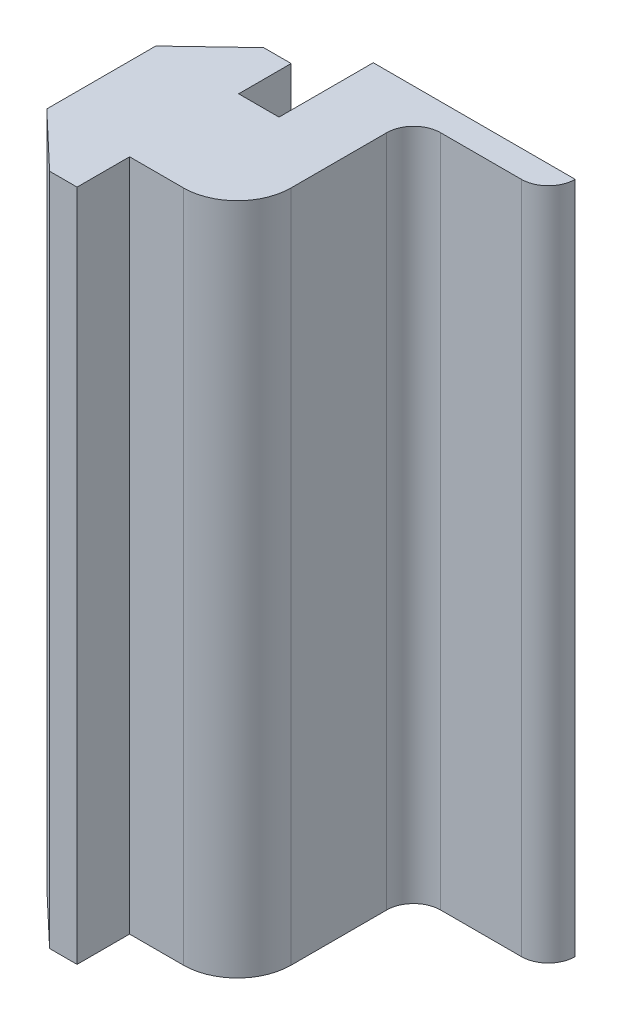
from build123d import *

# Parameters (mm, degrees)
SKETCH1_W           = 10
SKETCH1_H           = 2
BOSS_EXTRUDE1_DEPTH = 50
FILLET1_R           = 2
FILLET2_R           = 4
FILLET3_R           = 2


with BuildPart() as part:
    # Sketch1 → Boss-Extrude1 (new body)
    with BuildSketch(Plane(origin=(0, 0, 0), x_dir=(1, 0, 0), z_dir=(0, 1, 0))):
        Polygon((3, 4.05), (0, 4.05), (0, -4.05), (8, -4.05), (8, 4.05), align=None)
        Polygon((3, 11.05), (3, 4.05), (8, 4.05), (8, 9.05), (8, 11.05), align=None)
        Polygon((-2.04, 7.95), (0, 7.95), (0, -7.95), (-2.04, -7.95), (-6.152414984, -4.048), (-6.152414984, 4.048), align=None)
        with Locations((13, 10.05)):
            Rectangle(SKETCH1_W, SKETCH1_H)
    extrude(amount=BOSS_EXTRUDE1_DEPTH)

    # Fillet1
    fillet1_edges = [part.edges().sort_by_distance(p)[0] for p in [
        (8, 25, -9.05),
    ]]
    fillet(fillet1_edges, radius=FILLET1_R)

    # Fillet2
    fillet2_edges = [part.edges().sort_by_distance(p)[0] for p in [
        (8, 25, 4.05),
    ]]
    fillet(fillet2_edges, radius=FILLET2_R)

    # Fillet3
    fillet3_edges = [part.edges().sort_by_distance(p)[0] for p in [
        (18, 25, -9.05),
    ]]
    fillet(fillet3_edges, radius=FILLET3_R - 0.0001)  # a hair under: the kernel refuses the full size


solid = part.part
